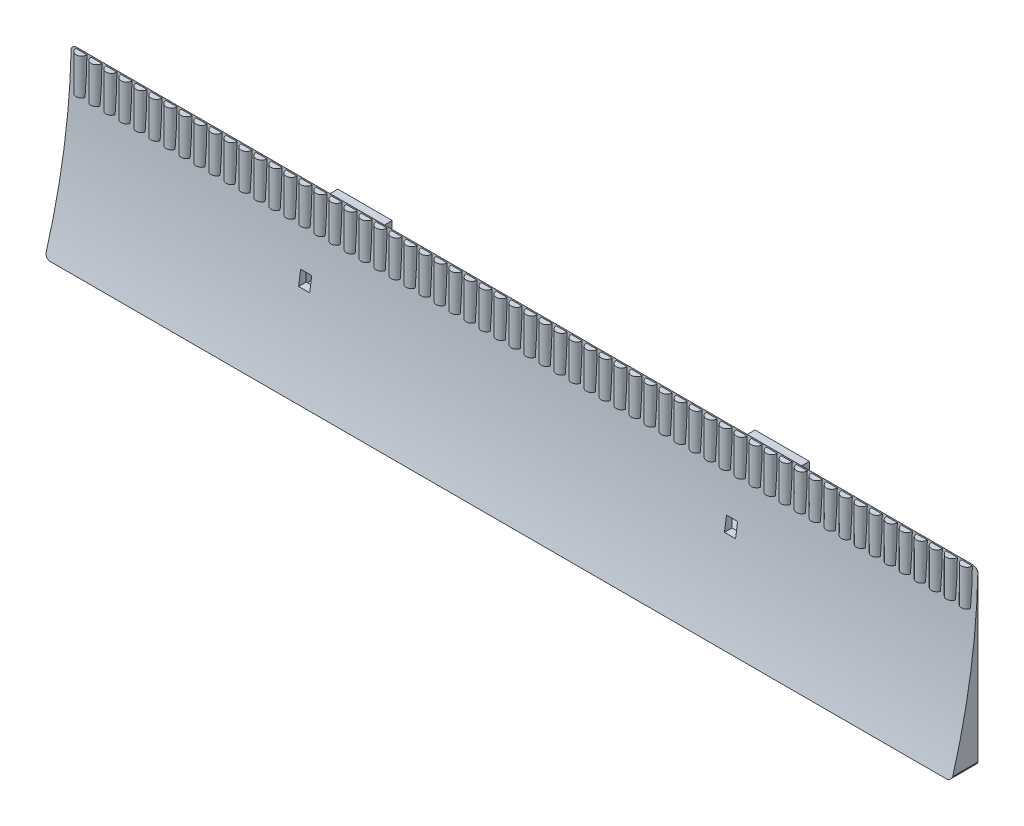
from build123d import *

# Parameters (mm, degrees)
ESQUISSE1_W                  = 500
ESQUISSE1_H                  = 100
BOSS_EXTRU_1_DEPTH           = 20
ENL_V_MAT_EXTRU_1_REACH      = 504.892
ESQUISSE3_W                  = 6.1
ESQUISSE3_H                  = 7.7
ENL_V_MAT_EXTRU_2_DEPTH      = 10
ESQUISSE4_W                  = 30
ESQUISSE4_H                  = 36.346168877
ESQUISSE4_W_2                = 24
ESQUISSE4_H_2                = 30.346168877
BOSS_EXTRU_2_DEPTH           = 25
ESQUISSE6_W                  = 30
ESQUISSE6_H                  = 36.346168877
BOSS_EXTRU_3_DEPTH           = 2
ESQUISSE7_W                  = 30
ESQUISSE7_H                  = 36.346168877
BOSS_EXTRU_4_DEPTH           = 2
ENL_V_START                  = -500
ENL_V_MAT_EXTRU_4_DEPTH      = 500
ENL_V_MAT_EXTRU_5_DEPTH      = 257.376676006
ENL_V_MAT_EXTRU_5_DEPTH_BACK = 257.376676006
ESQUISSE10_W                 = 2.019511338
ESQUISSE10_H                 = 1.006651579
ENL_V_MAT_EXTRU_6_DEPTH      = 10
BOSS_EXTRU_5_DEPTH           = 20


# Read off the part's stored shape, not the designer's step: Enlèv. mat.-Extru.4
with BuildPart() as part:
    # Esquisse1 → Boss.-Extru.1 (new body)
    with BuildSketch(Plane.XY):
        Rectangle(ESQUISSE1_W, ESQUISSE1_H)
    extrude(amount=BOSS_EXTRU_1_DEPTH)

    # Esquisse2 → Enlèv. mat.-Extru.1 (cut, up to next)
    with BuildSketch(Plane.ZY.offset(250), mode=Mode.PRIVATE) as enl_v_mat_extru_1_sk1:
        with BuildLine():
            Line((14.589803375, -50), (17, -50))
            Line((17, -50), (20, -50))
            Line((20, -50), (20, 50))
            Line((20, 50), (0, 50))
            ThreePointArc((0, 50), (3.666657093, -0.529353752), (14.589803375, -50))
        make_face()
    enl_v_mat_extru_1_tool1 = extrude(enl_v_mat_extru_1_sk1.sketch, amount=-ENL_V_MAT_EXTRU_1_REACH, mode=Mode.PRIVATE) & part.part
    add(enl_v_mat_extru_1_tool1.solids().sort_by_distance((-250, 7.975867, 11.791533))[0], mode=Mode.SUBTRACT)

    # Esquisse3 → Enlèv. mat.-Extru.2 (cut)
    with BuildSketch(Plane(origin=(0, 0, 0), x_dir=(-1, 0, 0), z_dir=(0, 0, -1))):
        with Locations((-117.418016387, 0)):
            Rectangle(ESQUISSE3_W, ESQUISSE3_H)
        with Locations((117.418016387, 0)):
            Rectangle(ESQUISSE3_W, ESQUISSE3_H)
    extrude(amount=-ENL_V_MAT_EXTRU_2_DEPTH, mode=Mode.SUBTRACT)

    # Esquisse4 → Boss.-Extru.2 (add)
    # profile 1 of 2: a face of its own
    with BuildSketch(Plane.XY):
        with Locations((-115, 4.12276014)):
            Rectangle(ESQUISSE4_W, ESQUISSE4_H)
        with Locations((-115, 4.12276014)):
            Rectangle(ESQUISSE4_W_2, ESQUISSE4_H_2, mode=Mode.SUBTRACT)
    # profile 2 of 2: a face of its own
    with BuildSketch(Plane.XY):
        with Locations((115, 4.12276014)):
            Rectangle(ESQUISSE4_W, ESQUISSE4_H)
        with Locations((115, 4.12276014)):
            Rectangle(ESQUISSE4_W_2, ESQUISSE4_H_2, mode=Mode.SUBTRACT)
    extrude(amount=-BOSS_EXTRU_2_DEPTH)

    # Esquisse6 → Boss.-Extru.3 (add)
    with BuildSketch(Plane(origin=(0, 0, -25), x_dir=(-1, 0, 0), z_dir=(0, 0, -1))):
        with Locations((-115, 4.12276014)):
            Rectangle(ESQUISSE6_W, ESQUISSE6_H)
    extrude(amount=BOSS_EXTRU_3_DEPTH)

    # Esquisse7 → Boss.-Extru.4 (add)
    with BuildSketch(Plane(origin=(0, 0, -25), x_dir=(-1, 0, 0), z_dir=(0, 0, -1))):
        with Locations((115, 4.12276014)):
            Rectangle(ESQUISSE7_W, ESQUISSE7_H)
    extrude(amount=BOSS_EXTRU_4_DEPTH)

    # Enlèv. mat.-Extru.4 outline → Enlèv. mat.-Extru.4 (cut)
    with BuildSketch(Plane.ZY.offset(250).offset(ENL_V_START)):
        with BuildLine():
            ThreePointArc((0, 45), (0.017729595, 45.017856687), (0.035712464, 45.000255089))
            ThreePointArc((0.035712464, 45.000255089), (0.00892823, 47.500063773), (0, 50))
            Line((0, 50), (0, 45))
        make_face()
    extrude(amount=ENL_V_MAT_EXTRU_4_DEPTH, mode=Mode.SUBTRACT)

    # Esquisse9 → Enlèv. mat.-Extru.5 (cut, two sides: drawn at the far end of the back side and taken through both)
    with BuildSketch(Plane(origin=(0, 0, 0), x_dir=(-1, 0, 0), z_dir=(0, 0, -1)).offset(-ENL_V_MAT_EXTRU_5_DEPTH_BACK)):
        with BuildLine():
            ThreePointArc((-247.319717596, -50), (-249.020065715, -49.309368485), (-250, -47.75763255))
            Line((-250, -47.75763255), (-250, -50))
            Line((-250, -50), (-247.319717596, -50))
        make_face()
        with BuildLine():
            ThreePointArc((-250, 42.757887639), (-249.021361983, 44.308538475), (-247.323088936, 45))
            Line((-247.323088936, 45), (-250, 45))
            Line((-250, 45), (-250, 42.757887639))
        make_face()
        with BuildLine():
            Line((250, -50), (250, -47.75763255))
            ThreePointArc((250, -47.75763255), (249.020065715, -49.309368485), (247.319717596, -50))
            Line((247.319717596, -50), (250, -50))
        make_face()
        with BuildLine():
            Line((250, 45), (247.323088936, 45))
            ThreePointArc((247.323088936, 45), (249.021361983, 44.308538475), (250, 42.757887639))
            Line((250, 42.757887639), (250, 45))
        make_face()
        Polygon((247.246595045, 45.856009348), (247.319717596, 45.000255089), (250, 45.000255089), (250.892679526, 45.736559015), align=None)
        Polygon((-249.948857824, 45.000255089), (-247.319717596, 45.000255089), (-247.074072756, 45.245899929), align=None)
        with BuildLine():
            Line((250, 45.000255089), (247.319717596, 45.000255089))
            ThreePointArc((247.319717596, 45.000255089), (247.321403302, 45.000128019), (247.323088936, 45))
            Line((247.323088936, 45), (250, 45))
            Line((250, 45), (250, 45.000255089))
        make_face()
        with BuildLine():
            ThreePointArc((-247.323088936, 45), (-247.321403302, 45.000128019), (-247.319717596, 45.000255089))
            Line((-247.319717596, 45.000255089), (-249.948857824, 45.000255089))
            Line((-249.948857824, 45.000255089), (-250, 45.000255089))
            Line((-250, 45.000255089), (-250, 45))
            Line((-250, 45), (-247.323088936, 45))
        make_face()
    extrude(amount=ENL_V_MAT_EXTRU_5_DEPTH + ENL_V_MAT_EXTRU_5_DEPTH_BACK, mode=Mode.SUBTRACT)


with BuildPart() as enl_v_mat_extru_5_piece_1:
    # of the separate pieces the step leaves, piece 1, a body of its own (enl_v_mat_extru_5_pieces)
    add(part.part.solids().sort_by_distance((247.319717596, -50, 0))[0])

    # Esquisse12 → Boss.-Extru.5 (add)
    with BuildSketch(Plane(origin=(0, 44.295844579, 0), x_dir=(1, 0, 0), z_dir=(0, 1, 0))):
        with BuildLine():
            Line((-247.319717596, -0.035712464), (-241.319717596, -0.035712464))
            ThreePointArc((-241.319717596, -0.035712464), (-244.319717596, -3.035712464), (-247.319717596, -0.035712464))
        make_face()
        with BuildLine():
            Line((-239.044182243, -0.035712464), (-233.044182243, -0.035712464))
            ThreePointArc((-233.044182243, -0.035712464), (-236.044182243, -3.035712464), (-239.044182243, -0.035712464))
        make_face()
        with BuildLine():
            Line((-230.768646889, -0.035712464), (-224.768646889, -0.035712464))
            ThreePointArc((-224.768646889, -0.035712464), (-227.768646889, -3.035712464), (-230.768646889, -0.035712464))
        make_face()
        with BuildLine():
            Line((-222.493111536, -0.035712464), (-216.493111536, -0.035712464))
            ThreePointArc((-216.493111536, -0.035712464), (-219.493111536, -3.035712464), (-222.493111536, -0.035712464))
        make_face()
        with BuildLine():
            Line((-214.217576183, -0.035712464), (-208.217576183, -0.035712464))
            ThreePointArc((-208.217576183, -0.035712464), (-211.217576183, -3.035712464), (-214.217576183, -0.035712464))
        make_face()
        with BuildLine():
            Line((-205.94204083, -0.035712464), (-199.94204083, -0.035712464))
            ThreePointArc((-199.94204083, -0.035712464), (-202.94204083, -3.035712464), (-205.94204083, -0.035712464))
        make_face()
        with BuildLine():
            Line((-197.666505476, -0.035712464), (-191.666505476, -0.035712464))
            ThreePointArc((-191.666505476, -0.035712464), (-194.666505476, -3.035712464), (-197.666505476, -0.035712464))
        make_face()
        with BuildLine():
            Line((-189.390970123, -0.035712464), (-183.390970123, -0.035712464))
            ThreePointArc((-183.390970123, -0.035712464), (-186.390970123, -3.035712464), (-189.390970123, -0.035712464))
        make_face()
        with BuildLine():
            Line((-181.11543477, -0.035712464), (-175.11543477, -0.035712464))
            ThreePointArc((-175.11543477, -0.035712464), (-178.11543477, -3.035712464), (-181.11543477, -0.035712464))
        make_face()
        with BuildLine():
            Line((-172.839899416, -0.035712464), (-166.839899416, -0.035712464))
            ThreePointArc((-166.839899416, -0.035712464), (-169.839899416, -3.035712464), (-172.839899416, -0.035712464))
        make_face()
        with BuildLine():
            Line((-164.564364063, -0.035712464), (-158.564364063, -0.035712464))
            ThreePointArc((-158.564364063, -0.035712464), (-161.564364063, -3.035712464), (-164.564364063, -0.035712464))
        make_face()
        with BuildLine():
            Line((-156.28882871, -0.035712464), (-150.28882871, -0.035712464))
            ThreePointArc((-150.28882871, -0.035712464), (-153.28882871, -3.035712464), (-156.28882871, -0.035712464))
        make_face()
        with BuildLine():
            Line((-148.013293356, -0.035712464), (-142.013293356, -0.035712464))
            ThreePointArc((-142.013293356, -0.035712464), (-145.013293356, -3.035712464), (-148.013293356, -0.035712464))
        make_face()
        with BuildLine():
            Line((-139.737758003, -0.035712464), (-133.737758003, -0.035712464))
            ThreePointArc((-133.737758003, -0.035712464), (-136.737758003, -3.035712464), (-139.737758003, -0.035712464))
        make_face()
        with BuildLine():
            Line((-131.46222265, -0.035712464), (-125.46222265, -0.035712464))
            ThreePointArc((-125.46222265, -0.035712464), (-128.46222265, -3.035712464), (-131.46222265, -0.035712464))
        make_face()
        with BuildLine():
            Line((-123.186687296, -0.035712464), (-117.186687296, -0.035712464))
            ThreePointArc((-117.186687296, -0.035712464), (-120.186687296, -3.035712464), (-123.186687296, -0.035712464))
        make_face()
        with BuildLine():
            Line((-114.911151943, -0.035712464), (-108.911151943, -0.035712464))
            ThreePointArc((-108.911151943, -0.035712464), (-111.911151943, -3.035712464), (-114.911151943, -0.035712464))
        make_face()
        with BuildLine():
            Line((-106.63561659, -0.035712464), (-100.63561659, -0.035712464))
            ThreePointArc((-100.63561659, -0.035712464), (-103.63561659, -3.035712464), (-106.63561659, -0.035712464))
        make_face()
        with BuildLine():
            Line((-98.360081237, -0.035712464), (-92.360081237, -0.035712464))
            ThreePointArc((-92.360081237, -0.035712464), (-95.360081237, -3.035712464), (-98.360081237, -0.035712464))
        make_face()
        with BuildLine():
            Line((-90.084545883, -0.035712464), (-84.084545883, -0.035712464))
            ThreePointArc((-84.084545883, -0.035712464), (-87.084545883, -3.035712464), (-90.084545883, -0.035712464))
        make_face()
        with BuildLine():
            Line((-81.80901053, -0.035712464), (-75.80901053, -0.035712464))
            ThreePointArc((-75.80901053, -0.035712464), (-78.80901053, -3.035712464), (-81.80901053, -0.035712464))
        make_face()
        with BuildLine():
            Line((-73.533475177, -0.035712464), (-67.533475177, -0.035712464))
            ThreePointArc((-67.533475177, -0.035712464), (-70.533475177, -3.035712464), (-73.533475177, -0.035712464))
        make_face()
        with BuildLine():
            Line((-65.257939823, -0.035712464), (-59.257939823, -0.035712464))
            ThreePointArc((-59.257939823, -0.035712464), (-62.257939823, -3.035712464), (-65.257939823, -0.035712464))
        make_face()
        with BuildLine():
            Line((-56.98240447, -0.035712464), (-50.98240447, -0.035712464))
            ThreePointArc((-50.98240447, -0.035712464), (-53.98240447, -3.035712464), (-56.98240447, -0.035712464))
        make_face()
        with BuildLine():
            Line((-48.706869117, -0.035712464), (-42.706869117, -0.035712464))
            ThreePointArc((-42.706869117, -0.035712464), (-45.706869117, -3.035712464), (-48.706869117, -0.035712464))
        make_face()
        with BuildLine():
            Line((-40.431333763, -0.035712464), (-34.431333763, -0.035712464))
            ThreePointArc((-34.431333763, -0.035712464), (-37.431333763, -3.035712464), (-40.431333763, -0.035712464))
        make_face()
        with BuildLine():
            Line((-32.15579841, -0.035712464), (-26.15579841, -0.035712464))
            ThreePointArc((-26.15579841, -0.035712464), (-29.15579841, -3.035712464), (-32.15579841, -0.035712464))
        make_face()
        with BuildLine():
            Line((-23.880263057, -0.035712464), (-17.880263057, -0.035712464))
            ThreePointArc((-17.880263057, -0.035712464), (-20.880263057, -3.035712464), (-23.880263057, -0.035712464))
        make_face()
        with BuildLine():
            Line((-15.604727703, -0.035712464), (-9.604727703, -0.035712464))
            ThreePointArc((-9.604727703, -0.035712464), (-12.604727703, -3.035712464), (-15.604727703, -0.035712464))
        make_face()
        with BuildLine():
            Line((-7.32919235, -0.035712464), (-1.32919235, -0.035712464))
            ThreePointArc((-1.32919235, -0.035712464), (-4.32919235, -3.035712464), (-7.32919235, -0.035712464))
        make_face()
        with BuildLine():
            Line((0.946343003, -0.035712464), (6.946343003, -0.035712464))
            ThreePointArc((6.946343003, -0.035712464), (3.946343003, -3.035712464), (0.946343003, -0.035712464))
        make_face()
        with BuildLine():
            Line((9.221878356, -0.035712464), (15.221878356, -0.035712464))
            ThreePointArc((15.221878356, -0.035712464), (12.221878356, -3.035712464), (9.221878356, -0.035712464))
        make_face()
        with BuildLine():
            Line((17.49741371, -0.035712464), (23.49741371, -0.035712464))
            ThreePointArc((23.49741371, -0.035712464), (20.49741371, -3.035712464), (17.49741371, -0.035712464))
        make_face()
        with BuildLine():
            Line((25.772949063, -0.035712464), (31.772949063, -0.035712464))
            ThreePointArc((31.772949063, -0.035712464), (28.772949063, -3.035712464), (25.772949063, -0.035712464))
        make_face()
        with BuildLine():
            Line((34.048484416, -0.035712464), (40.048484416, -0.035712464))
            ThreePointArc((40.048484416, -0.035712464), (37.048484416, -3.035712464), (34.048484416, -0.035712464))
        make_face()
        with BuildLine():
            Line((42.32401977, -0.035712464), (48.32401977, -0.035712464))
            ThreePointArc((48.32401977, -0.035712464), (45.32401977, -3.035712464), (42.32401977, -0.035712464))
        make_face()
        with BuildLine():
            Line((50.599555123, -0.035712464), (56.599555123, -0.035712464))
            ThreePointArc((56.599555123, -0.035712464), (53.599555123, -3.035712464), (50.599555123, -0.035712464))
        make_face()
        with BuildLine():
            Line((58.875090476, -0.035712464), (64.875090476, -0.035712464))
            ThreePointArc((64.875090476, -0.035712464), (61.875090476, -3.035712464), (58.875090476, -0.035712464))
        make_face()
        with BuildLine():
            Line((67.15062583, -0.035712464), (73.15062583, -0.035712464))
            ThreePointArc((73.15062583, -0.035712464), (70.15062583, -3.035712464), (67.15062583, -0.035712464))
        make_face()
        with BuildLine():
            Line((75.426161183, -0.035712464), (81.426161183, -0.035712464))
            ThreePointArc((81.426161183, -0.035712464), (78.426161183, -3.035712464), (75.426161183, -0.035712464))
        make_face()
        with BuildLine():
            Line((83.701696536, -0.035712464), (89.701696536, -0.035712464))
            ThreePointArc((89.701696536, -0.035712464), (86.701696536, -3.035712464), (83.701696536, -0.035712464))
        make_face()
        with BuildLine():
            Line((91.97723189, -0.035712464), (97.97723189, -0.035712464))
            ThreePointArc((97.97723189, -0.035712464), (94.97723189, -3.035712464), (91.97723189, -0.035712464))
        make_face()
        with BuildLine():
            Line((100.252767243, -0.035712464), (106.252767243, -0.035712464))
            ThreePointArc((106.252767243, -0.035712464), (103.252767243, -3.035712464), (100.252767243, -0.035712464))
        make_face()
        with BuildLine():
            Line((108.528302596, -0.035712464), (114.528302596, -0.035712464))
            ThreePointArc((114.528302596, -0.035712464), (111.528302596, -3.035712464), (108.528302596, -0.035712464))
        make_face()
        with BuildLine():
            Line((116.80383795, -0.035712464), (122.80383795, -0.035712464))
            ThreePointArc((122.80383795, -0.035712464), (119.80383795, -3.035712464), (116.80383795, -0.035712464))
        make_face()
        with BuildLine():
            Line((125.079373303, -0.035712464), (131.079373303, -0.035712464))
            ThreePointArc((131.079373303, -0.035712464), (128.079373303, -3.035712464), (125.079373303, -0.035712464))
        make_face()
        with BuildLine():
            Line((133.354908656, -0.035712464), (139.354908656, -0.035712464))
            ThreePointArc((139.354908656, -0.035712464), (136.354908656, -3.035712464), (133.354908656, -0.035712464))
        make_face()
        with BuildLine():
            Line((141.630444009, -0.035712464), (147.630444009, -0.035712464))
            ThreePointArc((147.630444009, -0.035712464), (144.630444009, -3.035712464), (141.630444009, -0.035712464))
        make_face()
        with BuildLine():
            Line((149.905979363, -0.035712464), (155.905979363, -0.035712464))
            ThreePointArc((155.905979363, -0.035712464), (152.905979363, -3.035712464), (149.905979363, -0.035712464))
        make_face()
        with BuildLine():
            Line((158.181514716, -0.035712464), (164.181514716, -0.035712464))
            ThreePointArc((164.181514716, -0.035712464), (161.181514716, -3.035712464), (158.181514716, -0.035712464))
        make_face()
        with BuildLine():
            Line((166.457050069, -0.035712464), (172.457050069, -0.035712464))
            ThreePointArc((172.457050069, -0.035712464), (169.457050069, -3.035712464), (166.457050069, -0.035712464))
        make_face()
        with BuildLine():
            Line((174.732585423, -0.035712464), (180.732585423, -0.035712464))
            ThreePointArc((180.732585423, -0.035712464), (177.732585423, -3.035712464), (174.732585423, -0.035712464))
        make_face()
        with BuildLine():
            Line((183.008120776, -0.035712464), (189.008120776, -0.035712464))
            ThreePointArc((189.008120776, -0.035712464), (186.008120776, -3.035712464), (183.008120776, -0.035712464))
        make_face()
        with BuildLine():
            Line((191.283656129, -0.035712464), (197.283656129, -0.035712464))
            ThreePointArc((197.283656129, -0.035712464), (194.283656129, -3.035712464), (191.283656129, -0.035712464))
        make_face()
        with BuildLine():
            Line((199.559191483, -0.035712464), (205.559191483, -0.035712464))
            ThreePointArc((205.559191483, -0.035712464), (202.559191483, -3.035712464), (199.559191483, -0.035712464))
        make_face()
        with BuildLine():
            Line((207.834726836, -0.035712464), (213.834726836, -0.035712464))
            ThreePointArc((213.834726836, -0.035712464), (210.834726836, -3.035712464), (207.834726836, -0.035712464))
        make_face()
        with BuildLine():
            Line((216.110262189, -0.035712464), (222.110262189, -0.035712464))
            ThreePointArc((222.110262189, -0.035712464), (219.110262189, -3.035712464), (216.110262189, -0.035712464))
        make_face()
        with BuildLine():
            Line((224.385797543, -0.035712464), (230.385797543, -0.035712464))
            ThreePointArc((230.385797543, -0.035712464), (227.385797543, -3.035712464), (224.385797543, -0.035712464))
        make_face()
        with BuildLine():
            Line((232.661332896, -0.035712464), (238.661332896, -0.035712464))
            ThreePointArc((238.661332896, -0.035712464), (235.661332896, -3.035712464), (232.661332896, -0.035712464))
        make_face()
        with BuildLine():
            Line((240.936868249, -0.035712464), (246.936868249, -0.035712464))
            ThreePointArc((246.936868249, -0.035712464), (243.936868249, -3.035712464), (240.936868249, -0.035712464))
        make_face()
    extrude(amount=-BOSS_EXTRU_5_DEPTH)


with BuildPart() as enl_v_mat_extru_5_piece_2:
    # of the separate pieces the step leaves, piece 2, a body of its own (enl_v_mat_extru_5_pieces)
    add(part.part.solids().sort_by_distance((250, 45.000255089, 1.822e-06))[0])

    # Esquisse10 → Enlèv. mat.-Extru.6 (cut)
    with BuildSketch(Plane(origin=(0, 0, 0), x_dir=(-1, 0, 0), z_dir=(0, 0, -1))):
        with Locations((-250.231334738, 45.231800482)):
            Rectangle(ESQUISSE10_W, ESQUISSE10_H)
    extrude(amount=-ENL_V_MAT_EXTRU_6_DEPTH, mode=Mode.SUBTRACT)


solid = enl_v_mat_extru_5_piece_1.part
